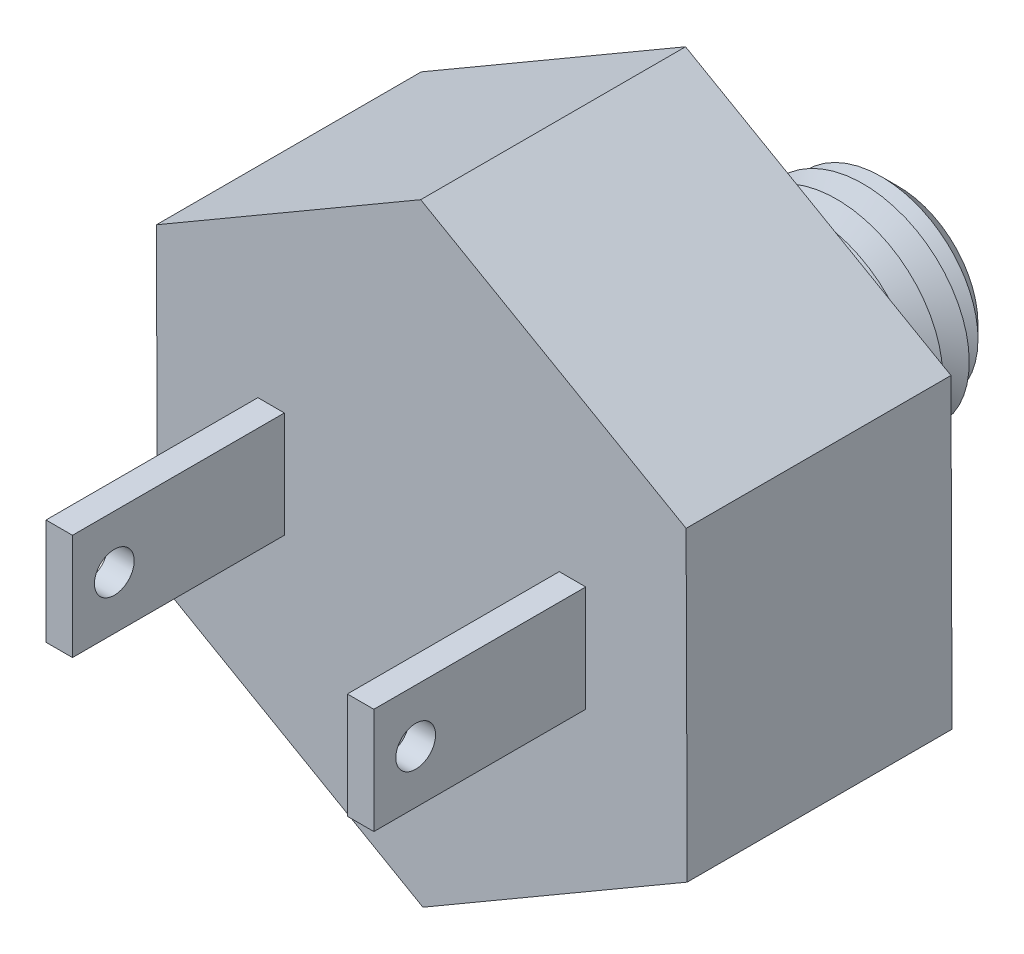
from build123d import *

# Parameters (mm, degrees)
RESSALTO_EXTRUS_O1_DEPTH  = 10
ESBO_O2_R                 = 4
RESSALTO_EXTRUS_O2_DEPTH  = 8
CHANFRO1_SIZE             = 1
VARREDURA_DE_CORTE8_PITCH = 1
VARREDURA_DE_CORTE8_TO    = 8
ESBO_O12_W                = 1
ESBO_O12_H                = 4
RESSALTO_EXTRUS_O3_DEPTH  = 8
ESBO_O13_R                = 0.750678363
CORTE_EXTRUS_O1_DEPTH     = 27.834751639


with BuildPart() as part:
    # Esboço1 → Ressalto-extrusão1 (new body)
    with BuildSketch(Plane.XY):
        Polygon((10.020934025, -5.737091127), (9.978933672, 5.809837872), (-0.042000352, 11.546928999), (-10.020934025, 5.737091127), (-9.978933672, -5.809837872), (0.042000352, -11.546928999), align=None)
    extrude(amount=RESSALTO_EXTRUS_O1_DEPTH)

    # Esboço2 → Ressalto-extrusão2 (add)
    with BuildSketch(Plane.XY):
        Circle(ESBO_O2_R)
    extrude(amount=-RESSALTO_EXTRUS_O2_DEPTH)

    # Chanfro1
    chanfro1_edges = [part.edges().sort_by_distance(p)[0] for p in [
        (-4, 0, -8),
    ]]
    chamfer(chanfro1_edges, length=CHANFRO1_SIZE)

    # Varredura de corte8: arcs per turn and ends read off the stored shape
    # Varredura de corte8: the profile of Esboço5 screwed along a right-hand helix through 9 turns, 8 arcs to a turn; built about Z, then put on its axis
    varredura_de_corte8_z = Axis((0, 0, 0), (0, 0, 1))
    varredura_de_corte8_corners = [(3.05, 0, 0), (4.475, 0, -0.822724134), (4.475, 0, 0.822724134)]
    with BuildLine(mode=Mode.PRIVATE) as varredura_de_corte8_profile:
        Line(varredura_de_corte8_corners[0], varredura_de_corte8_corners[1])
        Line(varredura_de_corte8_corners[1], varredura_de_corte8_corners[2])
        Line(varredura_de_corte8_corners[2], varredura_de_corte8_corners[0])
    varredura_de_corte8_cap = Face(varredura_de_corte8_profile.wire())
    varredura_de_corte8_turn_angles = [0, 22.5, 45, 67.5, 90, 112.5, 135, 157.5, 180, 202.5, 225, 247.5, 270, 292.5, 315, 337.5, 360]
    varredura_de_corte8_turn_weights = [1, 0.9238795325112867, 1, 0.9238795325112867, 1, 0.9238795325112867, 1, 0.9238795325112867, 1, 0.9238795325112867, 1, 0.9238795325112867, 1, 0.9238795325112867, 1, 0.9238795325112867, 1]
    varredura_de_corte8_turn_rails = [Edge.make_bspline([Vector(p[0], p[1], 0).rotate(varredura_de_corte8_z, varredura_de_corte8_turn_angles[k]) / varredura_de_corte8_turn_weights[k] + Vector(0, 0, p[2] + VARREDURA_DE_CORTE8_PITCH * varredura_de_corte8_turn_angles[k] / 360) for k in range(17)], [0, 0, 0, 1, 1, 2, 2, 3, 3, 4, 4, 5, 5, 6, 6, 7, 7, 8, 8, 8], 2, varredura_de_corte8_turn_weights) for p in varredura_de_corte8_corners]
    varredura_de_corte8_turn_sides = [Face.make_surface_from_curves(varredura_de_corte8_turn_rails[p[0]], varredura_de_corte8_turn_rails[p[1]]) for p in [(0, 1), (1, 2), (2, 0)]]
    varredura_de_corte8_turn = Solid(Shell([*varredura_de_corte8_turn_sides, varredura_de_corte8_cap, varredura_de_corte8_cap.rotate(varredura_de_corte8_z, 360).moved(Location((0, 0, VARREDURA_DE_CORTE8_PITCH * 360 / 360)))]))
    varredura_de_corte8_each = [*[varredura_de_corte8_turn.moved(Location((0, 0, VARREDURA_DE_CORTE8_PITCH * i))) for i in range(9)]]
    add(Plane(origin=(0, 0, -8), x_dir=(0, 1, 0), z_dir=(0, 0, 1)) * split(Compound([varredura_de_corte8_each[i] for i in range(0, 9, 2)]), bisect_by=Plane.XY.offset(VARREDURA_DE_CORTE8_TO), keep=Keep.BOTTOM, mode=Mode.PRIVATE), mode=Mode.SUBTRACT)
    add(Plane(origin=(0, 0, -8), x_dir=(0, 1, 0), z_dir=(0, 0, 1)) * split(Compound([varredura_de_corte8_each[i] for i in range(1, 9, 2)]), bisect_by=Plane.XY.offset(VARREDURA_DE_CORTE8_TO), keep=Keep.BOTTOM, mode=Mode.PRIVATE), mode=Mode.SUBTRACT)

    # Esboço12 → Ressalto-extrusão3 (add)
    with BuildSketch(Plane.XY.offset(10)):
        with Locations((5.689319542, 0)):
            Rectangle(ESBO_O12_W, ESBO_O12_H)
        with Locations((-5.689319542, 0)):
            Rectangle(ESBO_O12_W, ESBO_O12_H)
    extrude(amount=RESSALTO_EXTRUS_O3_DEPTH)

    # Esboço13 → Corte-extrusão1 (cut, through all)
    with BuildSketch(Plane.ZY.offset(6.189319542)):
        with Locations(Location((16.42064464, 0, 0), (0, 0, 270))):
            Circle(ESBO_O13_R)
    extrude(amount=-CORTE_EXTRUS_O1_DEPTH, mode=Mode.SUBTRACT)


solid = part.part
